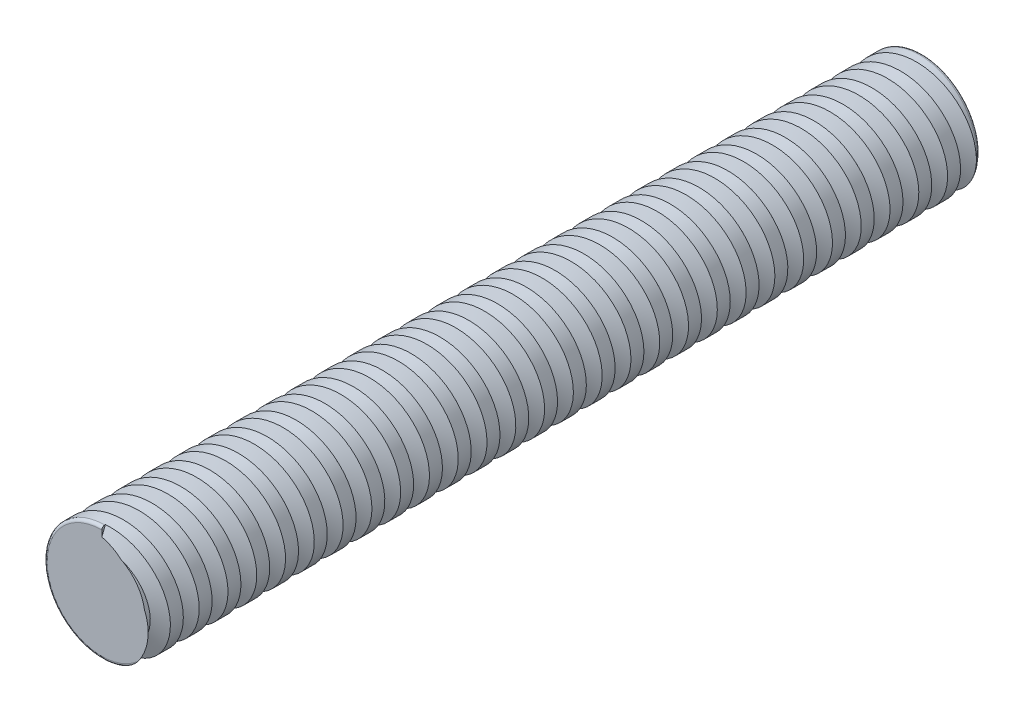
from build123d import *

# Parameters (mm, degrees)
SKETCH1_R           = 4
BOSS_EXTRUDE1_DEPTH = 57
FILLET1_R           = 0.2
CUT_SWEEP1_PITCH    = 2


with BuildPart() as part:
    # Sketch1 → Boss-Extrude1 (new body)
    with BuildSketch(Plane.XY):
        Circle(SKETCH1_R)
    extrude(amount=-BOSS_EXTRUDE1_DEPTH)

    # Fillet1
    fillet1_edges = [part.edges().sort_by_distance(p)[0] for p in [
        (-4, 0, 0),
        (-4, 0, -57),
    ]]
    fillet(fillet1_edges, radius=FILLET1_R)

    # Cut-Sweep1: arcs per turn and ends read off the stored shape
    # Cut-Sweep1: the profile of Sketch3 screwed along a right-hand helix through 28.5 turns, 10 arcs to a turn; built about Z, then put on its axis
    cut_sweep1_z = Axis((0, 0, 0), (0, 0, 1))
    cut_sweep1_corners = [(3, -5.24e-07, -0.150000056), (3, -5.24e-07, -0.450000056), (5, -8.73e-07, -1.250000056), (5, -8.73e-07, 0.649999944)]
    with BuildLine(mode=Mode.PRIVATE) as cut_sweep1_profile:
        Line(cut_sweep1_corners[0], cut_sweep1_corners[1])
        Line(cut_sweep1_corners[1], cut_sweep1_corners[2])
        Line(cut_sweep1_corners[2], cut_sweep1_corners[3])
        Line(cut_sweep1_corners[3], cut_sweep1_corners[0])
    cut_sweep1_cap = Face(cut_sweep1_profile.wire())
    cut_sweep1_turn_angles = [0, 18, 36, 54, 72, 90, 108, 126, 144, 162, 180, 198, 216, 234, 252, 270, 288, 306, 324, 342, 360]
    cut_sweep1_turn_weights = [1, 0.9510565162951535, 1, 0.9510565162951535, 1, 0.9510565162951535, 1, 0.9510565162951535, 1, 0.9510565162951535, 1, 0.9510565162951535, 1, 0.9510565162951535, 1, 0.9510565162951535, 1, 0.9510565162951535, 1, 0.9510565162951535, 1]
    cut_sweep1_turn_rails = [Edge.make_bspline([Vector(p[0], p[1], 0).rotate(cut_sweep1_z, cut_sweep1_turn_angles[k]) / cut_sweep1_turn_weights[k] + Vector(0, 0, p[2] + CUT_SWEEP1_PITCH * cut_sweep1_turn_angles[k] / 360) for k in range(21)], [0, 0, 0, 1, 1, 2, 2, 3, 3, 4, 4, 5, 5, 6, 6, 7, 7, 8, 8, 9, 9, 10, 10, 10], 2, cut_sweep1_turn_weights) for p in cut_sweep1_corners]
    cut_sweep1_turn_sides = [Face.make_surface_from_curves(cut_sweep1_turn_rails[p[0]], cut_sweep1_turn_rails[p[1]]) for p in [(0, 1), (1, 2), (2, 3), (3, 0)]]
    cut_sweep1_last_angles = [10080, 10098, 10116, 10134, 10152, 10170, 10188, 10206, 10224, 10242, 10260]
    cut_sweep1_last_weights = [1, 0.9510565162951535, 1, 0.9510565162951535, 1, 0.9510565162951535, 1, 0.9510565162951535, 1, 0.9510565162954283, 1]
    cut_sweep1_last_rails = [Edge.make_bspline([Vector(p[0], p[1], 0).rotate(cut_sweep1_z, cut_sweep1_last_angles[k]) / cut_sweep1_last_weights[k] + Vector(0, 0, p[2] + CUT_SWEEP1_PITCH * cut_sweep1_last_angles[k] / 360) for k in range(11)], [0, 0, 0, 1, 1, 2, 2, 3, 3, 4, 4, 5, 5, 5], 2, cut_sweep1_last_weights) for p in cut_sweep1_corners]
    cut_sweep1_last_sides = [Face.make_surface_from_curves(cut_sweep1_last_rails[p[0]], cut_sweep1_last_rails[p[1]]) for p in [(0, 1), (1, 2), (2, 3), (3, 0)]]
    cut_sweep1 = Plane(origin=(0, 0, 0), x_dir=(0, 1, 0), z_dir=(0, 0, -1)) * Solid(Shell([*[p.moved(Location((0, 0, CUT_SWEEP1_PITCH * i))) for i in range(28) for p in cut_sweep1_turn_sides], *cut_sweep1_last_sides, cut_sweep1_cap, cut_sweep1_cap.rotate(cut_sweep1_z, 10260).moved(Location((0, 0, CUT_SWEEP1_PITCH * 10260 / 360)))]))
    add(cut_sweep1, mode=Mode.SUBTRACT)


solid = part.part
